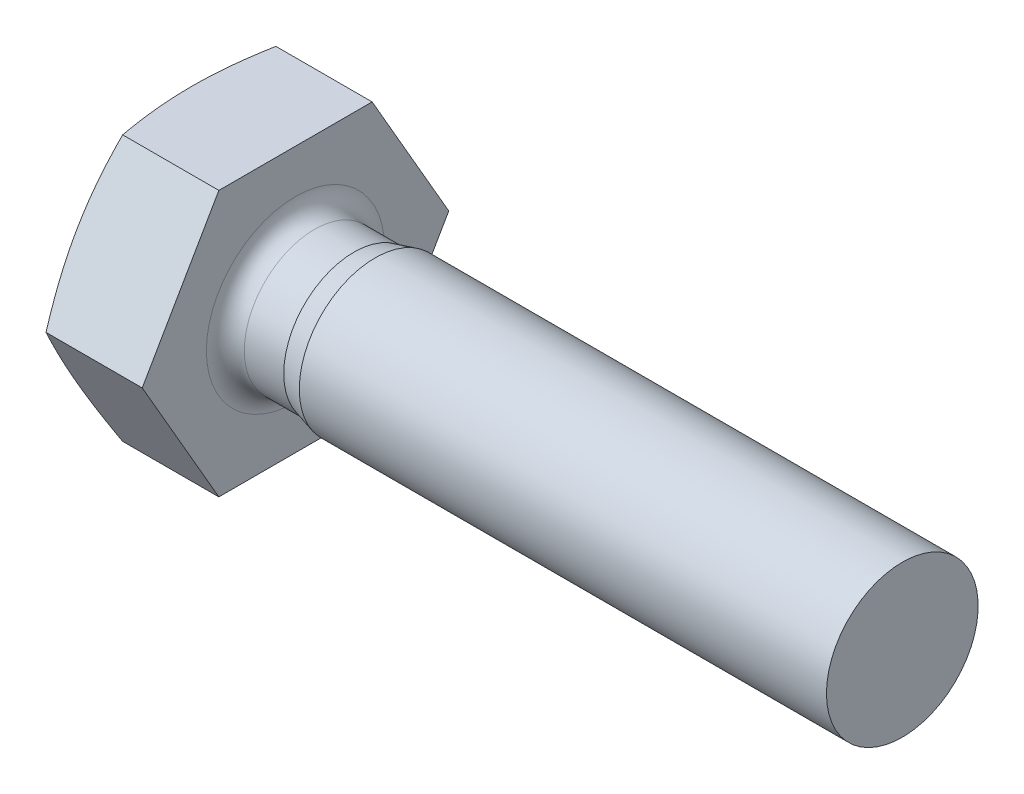
from build123d import *

# Parameters (mm, degrees)
BASEHEAD_DEPTH     = 2.8
SKETCH6_R          = 3.32
CUT_EXTRUDE1_DEPTH = 1.8
CUT_EXTRUDE2_DEPTH = 0.386
CIRPATTERN2_COUNT  = 2
CIRPATTERN2_ANGLE  = 90


with BuildPart() as part:
    # Sketch2 → BaseHead (new body)
    with BuildSketch(Plane(origin=(0, 0, 0), x_dir=(0, 0, -1), z_dir=(1, 0, 0))):
        Polygon((2.020725942, -3.5), (4.041451884, 0), (2.020725942, 3.5), (-2.020725942, 3.5), (-4.041451884, 0), (-2.020725942, -3.5), align=None)
    extrude(amount=BASEHEAD_DEPTH)

    # Sketch10 → Revolve1 (revolve)
    with BuildSketch(Plane(origin=(0, 0, 0), x_dir=(1, 0, 0), z_dir=(0, 1, 0))):
        with BuildLine():
            Line((2.8, 2.35), (2.8, 0))
            Line((2.8, 0), (18.8, 0))
            Line((18.8, 0), (18.8, 2))
            Line((18.8, 2), (4.9, 2))
            Line((4.9, 2), (4.340192379, 1.85))
            Line((4.340192379, 1.85), (3.3, 1.85))
            ThreePointArc((3.3, 1.85), (2.946446609, 1.996446609), (2.8, 2.35))
        make_face()
    revolve(axis=Axis((0, 0, 0), (1, 0, 0)))

    # Sketch5 → HeadChamfer (revolve, cut)
    with BuildSketch(Plane(origin=(0, 0, 0), x_dir=(1, 0, 0), z_dir=(0, 1, 0))):
        Polygon((0, 4.041451884), (0.262587011, 4.041451884), (0, 3.32), align=None)
    revolve(axis=Axis((-0.358389262, 0, 0), (1, 0, 0)), mode=Mode.SUBTRACT)

    # Sketch6 → Cut-Extrude1 (cut)
    with BuildSketch(Plane.ZY):
        Circle(SKETCH6_R)
    extrude(amount=-CUT_EXTRUDE1_DEPTH, mode=Mode.SUBTRACT)

    # Sketch7 → Cut-Extrude2 (cut, symmetric)
    with BuildSketch(Plane(origin=(0, 0, 0), x_dir=(1, 0, 0), z_dir=(0, 1, 0))):
        Polygon((3.73, 0), (1.3, 2.518134715), (1.3, -2.518134715), align=None)
    cut_extrude2 = extrude(amount=CUT_EXTRUDE2_DEPTH, both=True, mode=Mode.SUBTRACT)

    # CirPattern2: Cut-Extrude2 ×2 about axis
    cirpattern2_axis = Axis((1.8, 0, 0), (-1, 0, 0))
    for i in range(1, CIRPATTERN2_COUNT):
        add(cut_extrude2.rotate(cirpattern2_axis, i * CIRPATTERN2_ANGLE / (CIRPATTERN2_COUNT - 1)), mode=Mode.SUBTRACT)


solid = part.part
